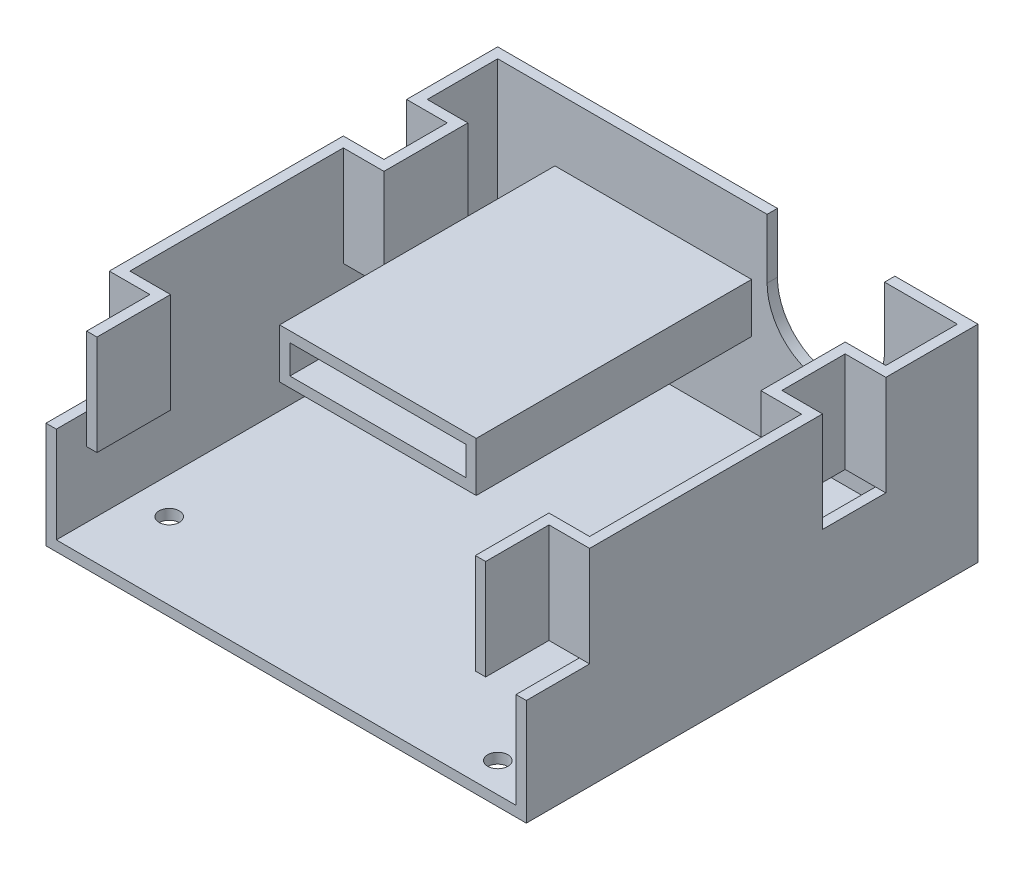
from build123d import *

# Parameters (mm, degrees)
SKETCH1_W            = 89.12
SKETCH1_H            = 85.57
BOSS_EXTRUDE1_DEPTH  = 2
SKETCH3_W            = 2
SKETCH3_H            = 30
BOSS_EXTRUDE2_DEPTH  = 85.57
SKETCH4_W            = 2
SKETCH4_H            = 30
BOSS_EXTRUDE3_DEPTH  = 85.57
SKETCH5_W            = 93.12
SKETCH5_H            = 2
BOSS_EXTRUDE4_DEPTH  = 30
SKETCH6_R            = 1.96
CUT_EXTRUDE2_DEPTH   = 30
SKETCH7_R            = 1.96
CUT_EXTRUDE3_DEPTH   = 30
SKETCH8_R            = 1.96
CUT_EXTRUDE4_DEPTH   = 30
SKETCH9_R            = 1.96
CUT_EXTRUDE5_DEPTH   = 30
BOSS_EXTRUDE5_DEPTH  = 9.4
SKETCH12_W           = 2
SKETCH12_H           = 12.27
CUT_EXTRUDE6_DEPTH   = 9.4
BOSS_EXTRUDE6_DEPTH  = 9.4
SKETCH14_W           = 2
SKETCH14_H           = 12.27
CUT_EXTRUDE7_DEPTH   = 9.4
BOSS_EXTRUDE7_DEPTH  = 9.4
SKETCH16_W           = 2
SKETCH16_H           = 12.27
CUT_EXTRUDE8_DEPTH   = 9.4
BOSS_EXTRUDE8_DEPTH  = 9.4
SKETCH18_W           = 2
SKETCH18_H           = 12.27
CUT_EXTRUDE9_DEPTH   = 9.4
BOSS_EXTRUDE9_DEPTH  = 10
SKETCH20_W           = 16
SKETCH20_H           = 42.55
BOSS_EXTRUDE10_DEPTH = 8.88
SKETCH21_W           = 16
SKETCH21_H           = 6.88
CUT_EXTRUDE10_DEPTH  = 42.55
SKETCH22_W           = 38.12
SKETCH22_H           = 9.59
BOSS_EXTRUDE11_DEPTH = 53.38
SKETCH23_W           = 34.12
SKETCH23_H           = 5.59
CUT_EXTRUDE11_DEPTH  = 53.38
SKETCH24_R           = 11.385
CUT_EXTRUDE12_DEPTH  = 53.4
SKETCH25_W           = 22.77
SKETCH25_H           = 11.565
CUT_EXTRUDE13_DEPTH  = 53.4


with BuildPart() as part:
    # Sketch1 → Boss-Extrude1 (new body)
    with BuildSketch(Plane(origin=(0, 0, 0), x_dir=(1, 0, 0), z_dir=(0, 1, 0))):
        with Locations((44.56, 42.785)):
            Rectangle(SKETCH1_W, SKETCH1_H)
    extrude(amount=BOSS_EXTRUDE1_DEPTH)

    # Sketch3 → Boss-Extrude2 (add)
    with BuildSketch(Plane.XY):
        with Locations((-1, 15)):
            Rectangle(SKETCH3_W, SKETCH3_H)
    extrude(amount=-BOSS_EXTRUDE2_DEPTH)

    # Sketch4 → Boss-Extrude3 (add)
    with BuildSketch(Plane.XY):
        with Locations((90.12, 15)):
            Rectangle(SKETCH4_W, SKETCH4_H)
    extrude(amount=-BOSS_EXTRUDE3_DEPTH)

    # Sketch5 → Boss-Extrude4 (add)
    with BuildSketch(Plane(origin=(0, 0, 0), x_dir=(1, 0, 0), z_dir=(0, 1, 0))):
        with Locations((44.56, 86.57)):
            Rectangle(SKETCH5_W, SKETCH5_H)
    extrude(amount=BOSS_EXTRUDE4_DEPTH)

    # Sketch6 → Cut-Extrude2 (cut)
    with BuildSketch(Plane(origin=(0, 0, 0), x_dir=(1, 0, 0), z_dir=(0, 1, 0))):
        with Locations((79.835, 5.755)):
            Circle(SKETCH6_R)
    extrude(amount=CUT_EXTRUDE2_DEPTH, mode=Mode.SUBTRACT)

    # Sketch7 → Cut-Extrude3 (cut)
    with BuildSketch(Plane(origin=(0, 2, 0), x_dir=(1, 0, 0), z_dir=(0, 1, 0))):
        with Locations((82.285, 76.225)):
            Circle(SKETCH7_R)
    extrude(amount=-CUT_EXTRUDE3_DEPTH, mode=Mode.SUBTRACT)

    # Sketch8 → Cut-Extrude4 (cut)
    with BuildSketch(Plane(origin=(0, 0, 0), x_dir=(1, 0, 0), z_dir=(0, 1, 0))):
        with Locations((6.985, 78.28)):
            Circle(SKETCH8_R)
    extrude(amount=CUT_EXTRUDE4_DEPTH, mode=Mode.SUBTRACT)

    # Sketch9 → Cut-Extrude5 (cut)
    with BuildSketch(Plane(origin=(0, 2, 0), x_dir=(1, 0, 0), z_dir=(0, 1, 0))):
        with Locations((7.035, 14.85)):
            Circle(SKETCH9_R)
    extrude(amount=-CUT_EXTRUDE5_DEPTH, mode=Mode.SUBTRACT)

    # Sketch11 → Boss-Extrude5 (add)
    with BuildSketch(Plane(origin=(0, 30, 0), x_dir=(1, 0, 0), z_dir=(0, 1, 0))):
        Polygon((81.24, 0), (83.24, 0), (83.24, 12.27), (89.12, 12.27), (89.12, 14.27), (81.24, 14.27), align=None)
    extrude(amount=-BOSS_EXTRUDE5_DEPTH)

    # Sketch12 → Cut-Extrude6 (cut)
    with BuildSketch(Plane(origin=(0, 30, 0), x_dir=(1, 0, 0), z_dir=(0, 1, 0))):
        with Locations((90.12, 6.135)):
            Rectangle(SKETCH12_W, SKETCH12_H)
    extrude(amount=-CUT_EXTRUDE6_DEPTH, mode=Mode.SUBTRACT)

    # Sketch13 → Boss-Extrude6 (add)
    with BuildSketch(Plane(origin=(0, 30, 0), x_dir=(1, 0, 0), z_dir=(0, 1, 0))):
        Polygon((89.12, 55.359786784), (89.12, 57.43), (83.24, 57.43), (83.24, 69.7), (89.12, 69.7), (89.12, 71.7), (81.24, 71.7), (81.24, 55.359786784), align=None)
    extrude(amount=-BOSS_EXTRUDE6_DEPTH)

    # Sketch14 → Cut-Extrude7 (cut)
    with BuildSketch(Plane(origin=(0, 30, 0), x_dir=(1, 0, 0), z_dir=(0, 1, 0))):
        with Locations((90.12, 63.565)):
            Rectangle(SKETCH14_W, SKETCH14_H)
    extrude(amount=-CUT_EXTRUDE7_DEPTH, mode=Mode.SUBTRACT)

    # Sketch15 → Boss-Extrude7 (add)
    with BuildSketch(Plane(origin=(0, 30, 0), x_dir=(1, 0, 0), z_dir=(0, 1, 0))):
        Polygon((5.88, 57.64), (0, 57.64), (0, 55.64), (7.88, 55.64), (7.88, 71.91), (0, 71.91), (0, 69.91), (5.88, 69.91), align=None)
    extrude(amount=-BOSS_EXTRUDE7_DEPTH)

    # Sketch16 → Cut-Extrude8 (cut)
    with BuildSketch(Plane(origin=(0, 30, 0), x_dir=(1, 0, 0), z_dir=(0, 1, 0))):
        with Locations((-1, 63.775)):
            Rectangle(SKETCH16_W, SKETCH16_H)
    extrude(amount=-CUT_EXTRUDE8_DEPTH, mode=Mode.SUBTRACT)

    # Sketch17 → Boss-Extrude8 (add)
    with BuildSketch(Plane(origin=(0, 30, 0), x_dir=(1, 0, 0), z_dir=(0, 1, 0))):
        Polygon((5.88, 12.27), (5.88, 0), (7.88, 0), (7.88, 14.27), (0, 14.27), (0, 12.27), align=None)
    extrude(amount=-BOSS_EXTRUDE8_DEPTH)

    # Sketch18 → Cut-Extrude9 (cut)
    with BuildSketch(Plane(origin=(0, 30, 0), x_dir=(1, 0, 0), z_dir=(0, 1, 0))):
        with Locations((-1, 6.135)):
            Rectangle(SKETCH18_W, SKETCH18_H)
    extrude(amount=-CUT_EXTRUDE9_DEPTH, mode=Mode.SUBTRACT)

    # Sketch19 → Boss-Extrude9 (add)
    with BuildSketch(Plane(origin=(0, 30, 0), x_dir=(1, 0, 0), z_dir=(0, 1, 0))):
        Polygon((83.24, 0), (81.24, 0), (81.24, 14.27), (89.12, 14.27), (89.12, 55.359786784), (81.24, 55.359786784), (81.24, 71.7), (89.12, 71.7), (89.12, 85.57), (0, 85.57), (0, 71.91), (7.88, 71.91), (7.88, 55.64), (0, 55.64), (0, 14.27), (7.88, 14.27), (7.88, 0), (5.88, 0), (5.88, 12.27), (-2, 12.27), (-2, 57.64), (5.88, 57.64), (5.88, 69.91), (-2, 69.91), (-2, 87.57), (91.12, 87.57), (91.12, 69.7), (83.24, 69.7), (83.24, 57.43), (91.12, 57.43), (91.12, 12.27), (83.24, 12.27), align=None)
    extrude(amount=BOSS_EXTRUDE9_DEPTH)

    # Sketch20 → Boss-Extrude10 (add)
    with BuildSketch(Plane(origin=(0, 2, 0), x_dir=(1, 0, 0), z_dir=(0, 1, 0))):
        with Locations((19.1, 64.295)):
            Rectangle(SKETCH20_W, SKETCH20_H)
    extrude(amount=BOSS_EXTRUDE10_DEPTH)

    # Sketch21 → Cut-Extrude10 (cut)
    with BuildSketch(Plane.XY.offset(-43.02)):
        with Locations((19.1, 5.44)):
            Rectangle(SKETCH21_W, SKETCH21_H)
    extrude(amount=-CUT_EXTRUDE10_DEPTH, mode=Mode.SUBTRACT)

    # Sketch22 → Boss-Extrude11 (add)
    with BuildSketch(Plane.XY.offset(-85.57)):
        with Locations((30.16, 22.763941004)):
            Rectangle(SKETCH22_W, SKETCH22_H)
    extrude(amount=BOSS_EXTRUDE11_DEPTH)

    # Sketch23 → Cut-Extrude11 (cut)
    with BuildSketch(Plane.XY.offset(-32.19)):
        with Locations((30.16, 22.763941004)):
            Rectangle(SKETCH23_W, SKETCH23_H)
    extrude(amount=-CUT_EXTRUDE11_DEPTH, mode=Mode.SUBTRACT)

    # Sketch24 → Cut-Extrude12 (cut)
    with BuildSketch(Plane.XY.offset(-85.57)):
        with Locations((63.62, 28.435)):
            Circle(SKETCH24_R)
    extrude(amount=-CUT_EXTRUDE12_DEPTH, mode=Mode.SUBTRACT)

    # Sketch25 → Cut-Extrude13 (cut)
    with BuildSketch(Plane.XY.offset(-85.57)):
        with Locations((63.62, 34.2175)):
            Rectangle(SKETCH25_W, SKETCH25_H)
    extrude(amount=-CUT_EXTRUDE13_DEPTH, mode=Mode.SUBTRACT)


solid = part.part
